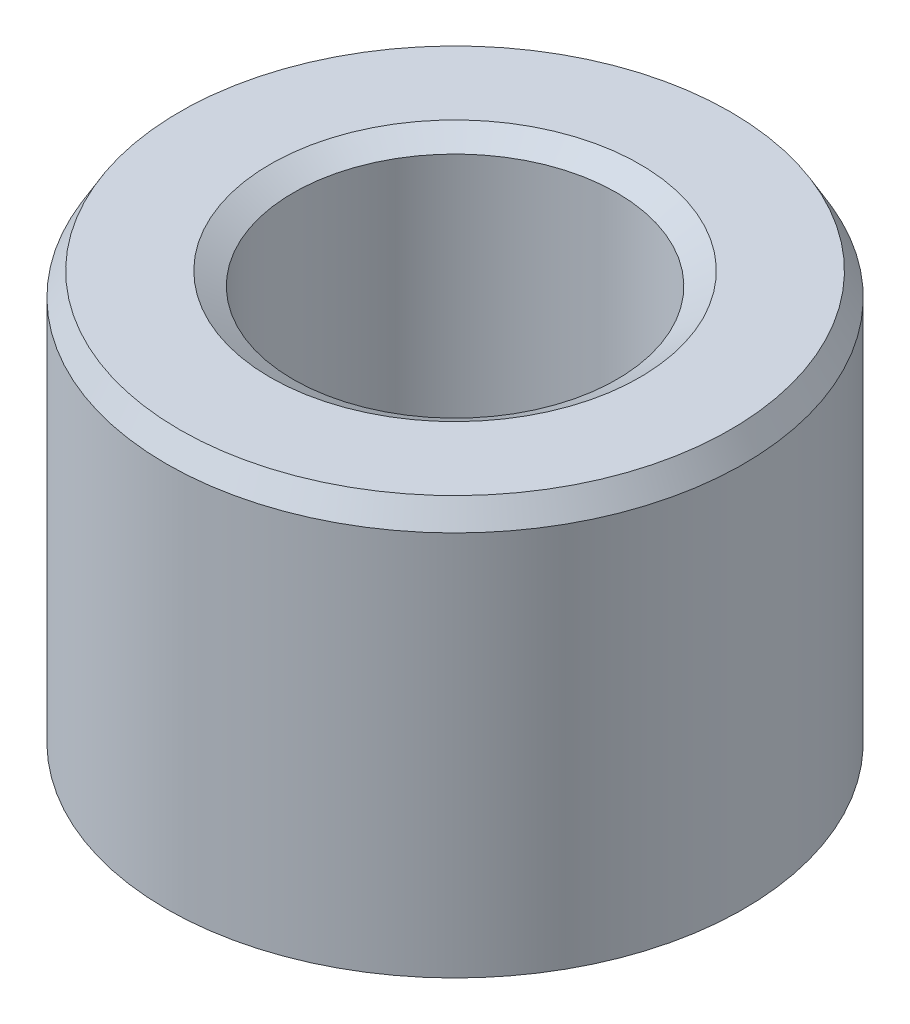
from build123d import *
from OCP.BRepFilletAPI import BRepFilletAPI_MakeChamfer

# Parameters (mm, degrees)
SKETCH1_R           = 22.5
BOSS_EXTRUDE1_DEPTH = 32.872325804
SKETCH2_R           = 12.611211501
CUT_EXTRUDE1_DEPTH  = 46.750298401
CHAMFER1_SIZE       = 1.792235259
CHAMFER1_SIZE2      = 1.034747509


with BuildPart() as part:
    # Sketch1 → Boss-Extrude1 (new body)
    with BuildSketch(Plane(origin=(0, 0, 0), x_dir=(1, 0, 0), z_dir=(0, 1, 0))):
        Circle(SKETCH1_R)
    extrude(amount=BOSS_EXTRUDE1_DEPTH)

    # Sketch2 → Cut-Extrude1 (cut, through all)
    with BuildSketch(Plane(origin=(0, 0, 0), x_dir=(1, 0, 0), z_dir=(0, 1, 0))):
        Circle(SKETCH2_R)
    extrude(amount=CUT_EXTRUDE1_DEPTH, mode=Mode.SUBTRACT)

    # Chamfer1: one chamfer whose edges measure the first distance from different faces: ONE call of the kernel's chamfer builder (chamfer() names one face for all edges)
    chamfer1_edges_1 = [part.edges().sort_by_distance(p)[0] for p in [
        (-12.611211501, 32.872325804, 0),
    ]]
    chamfer1_side_1 = [part.faces().sort_by_distance(p)[0] for p in [
        (-21.863603897, 32.872325804, 0),
    ]]
    chamfer1_edges_2 = [part.edges().sort_by_distance(p)[0] for p in [
        (-12.611211501, 0, 0),
    ]]
    chamfer1_side_2 = [part.faces().sort_by_distance(p)[0] for p in [
        (-12.611211501, 16.436162902, 0),
    ]]
    chamfer1_edges_3 = [part.edges().sort_by_distance(p)[0] for p in [
        (-22.5, 0, 0),
    ]]
    chamfer1_side_3 = [part.faces().sort_by_distance(p)[0] for p in [
        (-21.863603897, 0, 0),
    ]]
    chamfer1_edges_4 = [part.edges().sort_by_distance(p)[0] for p in [
        (-22.5, 32.872325804, 0),
    ]]
    chamfer1_side_4 = [part.faces().sort_by_distance(p)[0] for p in [
        (-22.5, 16.436162902, 0),
    ]]
    chamfer1 = BRepFilletAPI_MakeChamfer(part.part.solid().wrapped)
    for e in chamfer1_edges_1:
        chamfer1.Add(CHAMFER1_SIZE, CHAMFER1_SIZE2, e.wrapped, chamfer1_side_1[0].wrapped)  # the first distance lies on this face
    for e in chamfer1_edges_2:
        chamfer1.Add(CHAMFER1_SIZE, CHAMFER1_SIZE2, e.wrapped, chamfer1_side_2[0].wrapped)  # the first distance lies on this face
    for e in chamfer1_edges_3:
        chamfer1.Add(CHAMFER1_SIZE, CHAMFER1_SIZE2, e.wrapped, chamfer1_side_3[0].wrapped)  # the first distance lies on this face
    for e in chamfer1_edges_4:
        chamfer1.Add(CHAMFER1_SIZE, CHAMFER1_SIZE2, e.wrapped, chamfer1_side_4[0].wrapped)  # the first distance lies on this face
    add(Compound.cast(chamfer1.Shape()), mode=Mode.REPLACE)


solid = part.part
